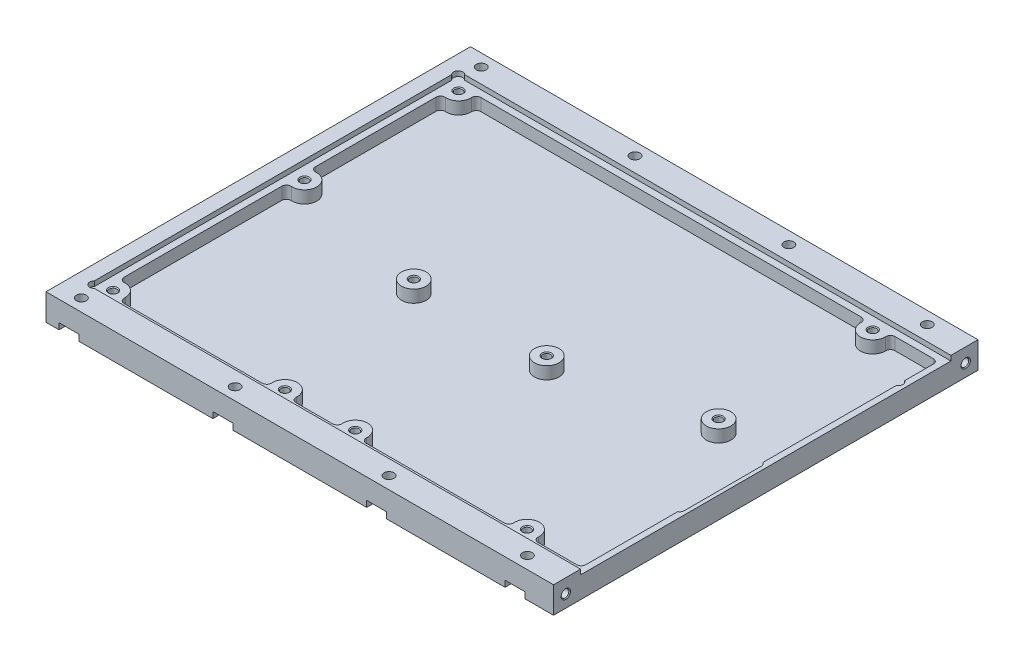
from build123d import *

# Parameters (mm, degrees)
SKETCH1_W                   = 165
SKETCH1_H                   = 138
BOSS_EXTRUDE1_DEPTH         = 7
SKETCH4_R                   = 1.25
CUT_EXTRUDE2_DEPTH          = 5
SKETCH5_R                   = 4
CUT_EXTRUDE3_DEPTH          = 4
BOSS_EXTRUDE2_DEPTH         = 1.6
CUT_EXTRUDE4_REACH          = 111.818
SKETCH7_R                   = 1.6
CUT_EXTRUDE5_DEPTH          = 2
M3_TAPPED_HOLE1_D           = 2.5
M3_TAPPED_HOLE1_DEPTH       = 7.5
M3_TAPPED_HOLE1_CSINK_D     = 3.05
M3_TAPPED_HOLE1_CSINK_ANGLE = 90
M3_TAPPED_HOLE1_TIP         = 0.751075774
M3_TAPPED_HOLE2_D           = 2.5
M3_TAPPED_HOLE2_DEPTH       = 7.5
M3_TAPPED_HOLE2_CSINK_D     = 3.05
M3_TAPPED_HOLE2_CSINK_ANGLE = 90
M3_TAPPED_HOLE2_TIP         = 0.751075774
M3_TAPPED_HOLE3_D           = 2.5
M3_TAPPED_HOLE3_DEPTH       = 5
M3_TAPPED_HOLE3_CSINK_D     = 3.05
M3_TAPPED_HOLE3_CSINK_ANGLE = 90
M3_TAPPED_HOLE3_TIP         = 0.751075774


with BuildPart() as part:
    # Sketch1 → Boss-Extrude1 (new body)
    with BuildSketch(Plane(origin=(0, 0, 0), x_dir=(1, 0, 0), z_dir=(0, 1, 0))):
        with Locations((-2.5, 0)):
            Rectangle(SKETCH1_W, SKETCH1_H)
    extrude(amount=BOSS_EXTRUDE1_DEPTH)

    # Sketch4 → Cut-Extrude2 (cut)
    with BuildSketch(Plane(origin=(0, 7, 0), x_dir=(1, 0, 0), z_dir=(0, 1, 0))):
        with Locations((-76.1, -56.1)):
            Circle(SKETCH4_R)
        with Locations((-20.22, -56.1)):
            Circle(SKETCH4_R)
        with Locations((2.64, -56.1)):
            Circle(SKETCH4_R)
        with Locations((58.49, -56.1)):
            Circle(SKETCH4_R)
        with Locations((-76.1, 6.13)):
            Circle(SKETCH4_R)
        with Locations((-30.38, -4.03)):
            Circle(SKETCH4_R)
        with Locations((58.52, 6.16)):
            Circle(SKETCH4_R)
        with Locations((12.8, -4)):
            Circle(SKETCH4_R)
    extrude(amount=-CUT_EXTRUDE2_DEPTH, mode=Mode.SUBTRACT)

    # Sketch5 → Cut-Extrude3 (cut)
    with BuildSketch(Plane(origin=(0, 7, 0), x_dir=(-1, 0, 0), z_dir=(0, -1, 0))):
        with BuildLine():
            Line((70.6, -58), (25.705435261, -58))
            ThreePointArc((25.705435261, -58), (24.606882494, -57.521362726), (24.209407462, -56.390909091))
            ThreePointArc((24.209407462, -56.390909091), (20.22, -52.1), (16.230592538, -56.390909091))
            ThreePointArc((16.230592538, -56.390909091), (15.833117506, -57.521362726), (14.734564739, -58))
            Line((14.734564739, -58), (2.845435261, -58))
            ThreePointArc((2.845435261, -58), (1.746882494, -57.521362726), (1.349407462, -56.390909091))
            ThreePointArc((1.349407462, -56.390909091), (-2.64, -52.1), (-6.629407462, -56.390909091))
            ThreePointArc((-6.629407462, -56.390909091), (-7.026882494, -57.521362726), (-8.125435261, -58))
            Line((-8.125435261, -58), (-53.004564739, -58))
            ThreePointArc((-53.004564739, -58), (-54.103117506, -57.521362726), (-54.500592538, -56.390909091))
            ThreePointArc((-54.500592538, -56.390909091), (-58.49, -52.1), (-62.479407462, -56.390909091))
            ThreePointArc((-62.479407462, -56.390909091), (-62.876882494, -57.521362726), (-63.975435261, -58))
            Line((-63.975435261, -58), (-76.5, -58))
            ThreePointArc((-76.5, -58), (-77.560660172, -57.560660172), (-78, -56.5))
            Line((-78, -56.5), (-78, -26.626649916))
            ThreePointArc((-78, -26.626649916), (-78.584523258, -26.074596669), (-78.8, -25.3))
            Line((-78.8, -25.3), (-78.8, -0.3))
            ThreePointArc((-78.8, -0.3), (-78.584523258, 0.474596669), (-78, 1.026649916))
            Line((-78, 1.026649916), (-78, 44.473350084))
            ThreePointArc((-78, 44.473350084), (-78.8, 45.8), (-78, 47.126649916))
            Line((-78, 47.126649916), (-78, 56.5))
            ThreePointArc((-78, 56.5), (-77.560660172, 57.560660172), (-76.5, 58))
            Line((-76.5, 58), (-64.015188805, 58))
            ThreePointArc((-64.015188805, 58), (-62.932578323, 57.538245898), (-62.516500949, 56.437272727))
            ThreePointArc((-62.516500949, 56.437272727), (-58.52, 52.27), (-54.523499051, 56.437272727))
            ThreePointArc((-54.523499051, 56.437272727), (-54.107421677, 57.538245898), (-53.024811195, 58))
            Line((-53.024811195, 58), (70.606148892, 58))
            ThreePointArc((70.606148892, 58), (71.691589732, 57.535286522), (72.104471921, 56.429090909))
            ThreePointArc((72.104471921, 56.429090909), (73.307865938, 53.375739645), (76.390909091, 52.250592538))
            ThreePointArc((76.390909091, 52.250592538), (77.521362726, 51.853117506), (78, 50.754564739))
            Line((78, 50.754564739), (78, 11.615435261))
            ThreePointArc((78, 11.615435261), (77.521362726, 10.516882494), (76.390909091, 10.119407462))
            ThreePointArc((76.390909091, 10.119407462), (72.1, 6.13), (76.390909091, 2.140592538))
            ThreePointArc((76.390909091, 2.140592538), (77.521362726, 1.743117506), (78, 0.644564739))
            Line((78, 0.644564739), (78, -50.6))
            ThreePointArc((78, -50.6), (77.560660172, -51.660660172), (76.5, -52.1))
            Line((76.5, -52.1), (76.1, -52.1))
            ThreePointArc((76.1, -52.1), (73.271572875, -53.271572875), (72.1, -56.1))
            Line((72.1, -56.1), (72.1, -56.5))
            ThreePointArc((72.1, -56.5), (71.660660172, -57.560660172), (70.6, -58))
        make_face()
        with Locations((30.38, -4.03)):
            Circle(SKETCH5_R, mode=Mode.SUBTRACT)
        with Locations((-12.8, -4)):
            Circle(SKETCH5_R, mode=Mode.SUBTRACT)
        with Locations((-58.52, 6.16)):
            Circle(SKETCH5_R, mode=Mode.SUBTRACT)
    extrude(amount=CUT_EXTRUDE3_DEPTH, mode=Mode.SUBTRACT)

    # Sketch6 → Boss-Extrude2 (add)
    with BuildSketch(Plane(origin=(0, 7, 0), x_dir=(1, 0, 0), z_dir=(0, 1, 0))):
        with BuildLine():
            Line((-78.078679656, 60.2), (80, 60.2))
            Line((80, 60.2), (80, 69))
            Line((80, 69), (-85, 69))
            Line((-85, 69), (-85, -69))
            Line((-85, -69), (80, -69))
            Line((80, -69), (80, -60.2))
            Line((80, -60.2), (-78.078679656, -60.2))
            ThreePointArc((-78.078679656, -60.2), (-80.2, -60.2), (-80.2, -58.078679656))
            Line((-80.2, -58.078679656), (-80.2, 58.078679656))
            ThreePointArc((-80.2, 58.078679656), (-80.2, 60.2), (-78.078679656, 60.2))
        make_face()
    extrude(amount=BOSS_EXTRUDE2_DEPTH)

    # Sketch7 → Cut-Extrude4 (cut, up to next)
    with BuildSketch(Plane(origin=(0, 8.6, 0), x_dir=(1, 0, 0), z_dir=(0, 1, 0)), mode=Mode.PRIVATE) as cut_extrude4_sk1:
        with Locations((-77.5, -65)):
            Circle(SKETCH7_R)
    cut_extrude4_tool1 = extrude(cut_extrude4_sk1.sketch, amount=-CUT_EXTRUDE4_REACH, mode=Mode.PRIVATE) & part.part
    # Sketch7 → Cut-Extrude4 (cut, up to next)
    with BuildSketch(Plane(origin=(0, 8.6, 0), x_dir=(1, 0, 0), z_dir=(0, 1, 0)), mode=Mode.PRIVATE) as cut_extrude4_sk2:
        with Locations((-27.5, -65)):
            Circle(SKETCH7_R)
    cut_extrude4_tool2 = extrude(cut_extrude4_sk2.sketch, amount=-CUT_EXTRUDE4_REACH, mode=Mode.PRIVATE) & part.part
    # Sketch7 → Cut-Extrude4 (cut, up to next)
    with BuildSketch(Plane(origin=(0, 8.6, 0), x_dir=(1, 0, 0), z_dir=(0, 1, 0)), mode=Mode.PRIVATE) as cut_extrude4_sk3:
        with Locations((22.5, -65)):
            Circle(SKETCH7_R)
    cut_extrude4_tool3 = extrude(cut_extrude4_sk3.sketch, amount=-CUT_EXTRUDE4_REACH, mode=Mode.PRIVATE) & part.part
    # Sketch7 → Cut-Extrude4 (cut, up to next)
    with BuildSketch(Plane(origin=(0, 8.6, 0), x_dir=(1, 0, 0), z_dir=(0, 1, 0)), mode=Mode.PRIVATE) as cut_extrude4_sk4:
        with Locations((67.5, -65)):
            Circle(SKETCH7_R)
    cut_extrude4_tool4 = extrude(cut_extrude4_sk4.sketch, amount=-CUT_EXTRUDE4_REACH, mode=Mode.PRIVATE) & part.part
    # Sketch7 → Cut-Extrude4 (cut, up to next)
    with BuildSketch(Plane(origin=(0, 8.6, 0), x_dir=(1, 0, 0), z_dir=(0, 1, 0)), mode=Mode.PRIVATE) as cut_extrude4_sk5:
        with Locations((-77.5, 65)):
            Circle(SKETCH7_R)
    cut_extrude4_tool5 = extrude(cut_extrude4_sk5.sketch, amount=-CUT_EXTRUDE4_REACH, mode=Mode.PRIVATE) & part.part
    # Sketch7 → Cut-Extrude4 (cut, up to next)
    with BuildSketch(Plane(origin=(0, 8.6, 0), x_dir=(1, 0, 0), z_dir=(0, 1, 0)), mode=Mode.PRIVATE) as cut_extrude4_sk6:
        with Locations((-27.5, 65)):
            Circle(SKETCH7_R)
    cut_extrude4_tool6 = extrude(cut_extrude4_sk6.sketch, amount=-CUT_EXTRUDE4_REACH, mode=Mode.PRIVATE) & part.part
    # Sketch7 → Cut-Extrude4 (cut, up to next)
    with BuildSketch(Plane(origin=(0, 8.6, 0), x_dir=(1, 0, 0), z_dir=(0, 1, 0)), mode=Mode.PRIVATE) as cut_extrude4_sk7:
        with Locations((22.5, 65)):
            Circle(SKETCH7_R)
    cut_extrude4_tool7 = extrude(cut_extrude4_sk7.sketch, amount=-CUT_EXTRUDE4_REACH, mode=Mode.PRIVATE) & part.part
    # Sketch7 → Cut-Extrude4 (cut, up to next)
    with BuildSketch(Plane(origin=(0, 8.6, 0), x_dir=(1, 0, 0), z_dir=(0, 1, 0)), mode=Mode.PRIVATE) as cut_extrude4_sk8:
        with Locations((67.5, 65)):
            Circle(SKETCH7_R)
    cut_extrude4_tool8 = extrude(cut_extrude4_sk8.sketch, amount=-CUT_EXTRUDE4_REACH, mode=Mode.PRIVATE) & part.part
    add(cut_extrude4_tool1.solids().sort_by_distance((-77.5, 8.6, 65))[0], mode=Mode.SUBTRACT)
    add(cut_extrude4_tool2.solids().sort_by_distance((-27.5, 8.6, 65))[0], mode=Mode.SUBTRACT)
    add(cut_extrude4_tool3.solids().sort_by_distance((22.5, 8.6, 65))[0], mode=Mode.SUBTRACT)
    add(cut_extrude4_tool4.solids().sort_by_distance((67.5, 8.6, 65))[0], mode=Mode.SUBTRACT)
    add(cut_extrude4_tool5.solids().sort_by_distance((-77.5, 8.6, -65))[0], mode=Mode.SUBTRACT)
    add(cut_extrude4_tool6.solids().sort_by_distance((-27.5, 8.6, -65))[0], mode=Mode.SUBTRACT)
    add(cut_extrude4_tool7.solids().sort_by_distance((22.5, 8.6, -65))[0], mode=Mode.SUBTRACT)
    add(cut_extrude4_tool8.solids().sort_by_distance((67.5, 8.6, -65))[0], mode=Mode.SUBTRACT)

    # Sketch8 → Cut-Extrude5 (cut)
    with BuildSketch(Plane(origin=(0, 0, 0), x_dir=(-1, 0, 0), z_dir=(0, -1, 0))):
        with BuildLine():
            Line((-70.75, -65), (-70.75, -69))
            Line((-70.75, -69), (-64.25, -69))
            Line((-64.25, -69), (-64.25, -65))
            ThreePointArc((-64.25, -65), (-67.5, -61.75), (-70.75, -65))
        make_face()
        with BuildLine():
            Line((-25.75, -65), (-25.75, -69))
            Line((-25.75, -69), (-19.25, -69))
            Line((-19.25, -69), (-19.25, -65))
            ThreePointArc((-19.25, -65), (-22.5, -61.75), (-25.75, -65))
        make_face()
        with BuildLine():
            Line((24.25, -65), (24.25, -69))
            Line((24.25, -69), (30.75, -69))
            Line((30.75, -69), (30.75, -65))
            ThreePointArc((30.75, -65), (27.5, -61.75), (24.25, -65))
        make_face()
        with BuildLine():
            Line((74.25, -65), (74.25, -69))
            Line((74.25, -69), (80.75, -69))
            Line((80.75, -69), (80.75, -65))
            ThreePointArc((80.75, -65), (77.5, -61.75), (74.25, -65))
        make_face()
        with BuildLine():
            Line((80.75, 65), (80.75, 69))
            Line((80.75, 69), (74.25, 69))
            Line((74.25, 69), (74.25, 65))
            ThreePointArc((74.25, 65), (77.5, 61.75), (80.75, 65))
        make_face()
        with BuildLine():
            Line((30.75, 65), (30.75, 69))
            Line((30.75, 69), (24.25, 69))
            Line((24.25, 69), (24.25, 65))
            ThreePointArc((24.25, 65), (27.5, 61.75), (30.75, 65))
        make_face()
        with BuildLine():
            Line((-19.25, 65), (-19.25, 69))
            Line((-19.25, 69), (-25.75, 69))
            Line((-25.75, 69), (-25.75, 65))
            ThreePointArc((-25.75, 65), (-22.5, 61.75), (-19.25, 65))
        make_face()
        with BuildLine():
            Line((-64.25, 65), (-64.25, 69))
            Line((-64.25, 69), (-70.75, 69))
            Line((-70.75, 69), (-70.75, 65))
            ThreePointArc((-70.75, 65), (-67.5, 61.75), (-64.25, 65))
        make_face()
    extrude(amount=-CUT_EXTRUDE5_DEPTH, mode=Mode.SUBTRACT)

    # M3 Tapped Hole1
    with Locations(Plane(origin=(0, 0, 0), x_dir=(-1, 0, 0), z_dir=(0, -1, 0))):
        with Locations((70, -64.6), (2.5, -64.6), (-60, -64.6), (2.5, 64.6), (70, 64.6), (-60, 64.6)):
            CounterSinkHole(M3_TAPPED_HOLE1_D / 2, M3_TAPPED_HOLE1_CSINK_D / 2, depth=M3_TAPPED_HOLE1_DEPTH, counter_sink_angle=M3_TAPPED_HOLE1_CSINK_ANGLE)
            with Locations((0, 0, -(M3_TAPPED_HOLE1_DEPTH + M3_TAPPED_HOLE1_TIP / 2))):  # 118° drill point
                Cone(0, M3_TAPPED_HOLE1_D / 2, M3_TAPPED_HOLE1_TIP, mode=Mode.SUBTRACT)

    # M3 Tapped Hole2
    with Locations(Plane(origin=(80, 0, 0), x_dir=(0, 0, -1), z_dir=(1, 0, 0))):
        with Locations((-65, 4), (65, 4)):
            CounterSinkHole(M3_TAPPED_HOLE2_D / 2, M3_TAPPED_HOLE2_CSINK_D / 2, depth=M3_TAPPED_HOLE2_DEPTH, counter_sink_angle=M3_TAPPED_HOLE2_CSINK_ANGLE)
            with Locations((0, 0, -(M3_TAPPED_HOLE2_DEPTH + M3_TAPPED_HOLE2_TIP / 2))):  # 118° drill point
                Cone(0, M3_TAPPED_HOLE2_D / 2, M3_TAPPED_HOLE2_TIP, mode=Mode.SUBTRACT)

    # M3 Tapped Hole3
    with Locations(Plane(origin=(0, 7, 0), x_dir=(1, 0, 0), z_dir=(0, 1, 0))):
        with Locations((-76.1, 6.13), (-30.38, -4.03), (12.8, -4), (58.52, 6.16), (-76.1, -56.1), (-20.22, -56.1), (2.64, -56.1), (58.49, -56.1), (-76.1, 56.24), (58.52, 56.27)):
            CounterSinkHole(M3_TAPPED_HOLE3_D / 2, M3_TAPPED_HOLE3_CSINK_D / 2, depth=M3_TAPPED_HOLE3_DEPTH, counter_sink_angle=M3_TAPPED_HOLE3_CSINK_ANGLE)
            with Locations((0, 0, -(M3_TAPPED_HOLE3_DEPTH + M3_TAPPED_HOLE3_TIP / 2))):  # 118° drill point
                Cone(0, M3_TAPPED_HOLE3_D / 2, M3_TAPPED_HOLE3_TIP, mode=Mode.SUBTRACT)


solid = part.part
